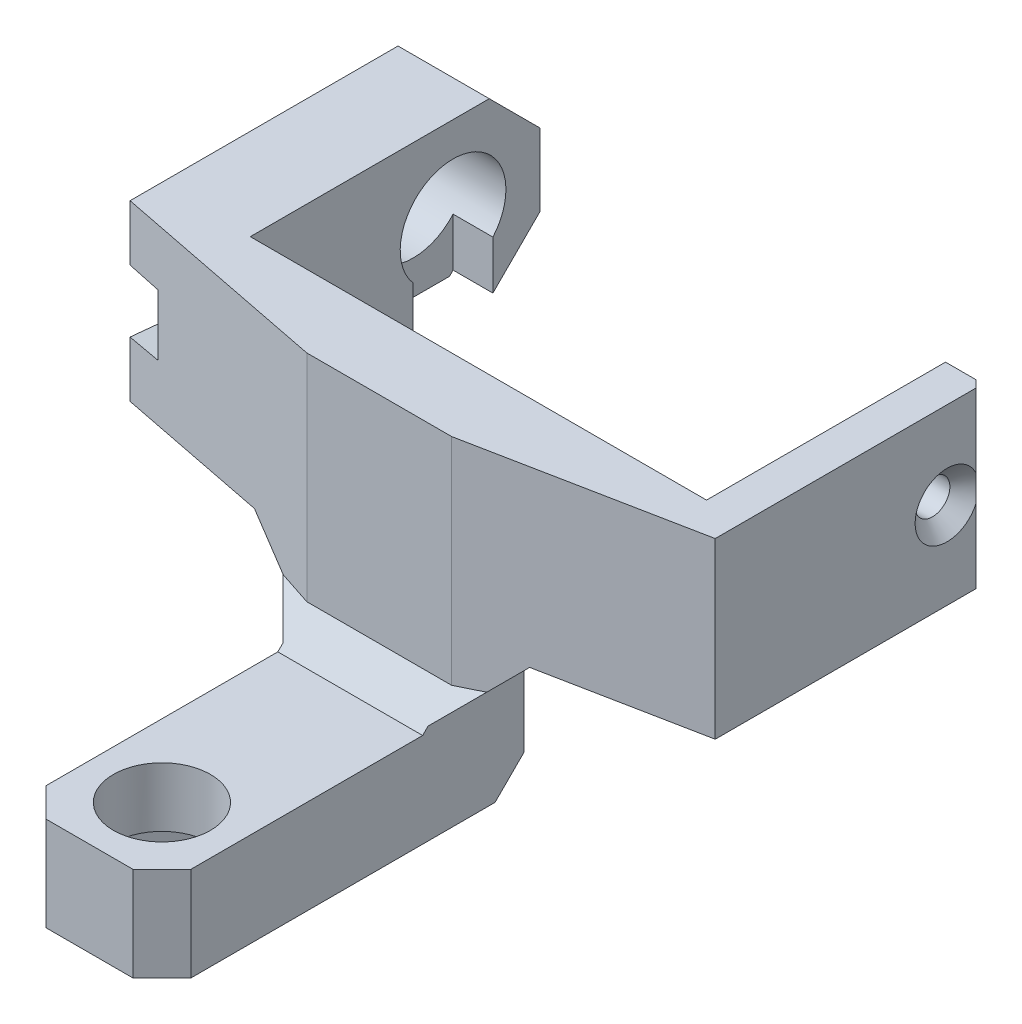
from build123d import *

# Parameters (mm, degrees)
SKETCH1_W                                       = 40.4
SKETCH1_H                                       = 12
BOSS_EXTRUDE1_DEPTH                             = 22
CUT_EXTRUDE1_REACH                              = 34.188
SKETCH2_W                                       = 31.5
SKETCH2_H                                       = 20
CUT_EXTRUDE2_REACH                              = 48.391
SKETCH4_R                                       = 0.9
CHAMFER1_SIZE                                   = 3.5
CSK_FOR_M2_FLAT_HEAD_MACHINE_SCREW1_D           = 2.4
CSK_FOR_M2_FLAT_HEAD_MACHINE_SCREW1_DEPTH       = 12.7
CSK_FOR_M2_FLAT_HEAD_MACHINE_SCREW1_CSINK_D     = 4.4
CSK_FOR_M2_FLAT_HEAD_MACHINE_SCREW1_CSINK_ANGLE = 90
CSK_FOR_M2_FLAT_HEAD_MACHINE_SCREW1_TIP         = 0.721032743
CHAMFER2_SIZE                                   = 4
BOSS_EXTRUDE2_START                             = 0.5
SKETCH20_R                                      = 2.5
SKETCH20_R_2                                    = 1.2
BOSS_EXTRUDE2_DEPTH                             = 0.5
BOSS_EXTRUDE3_DEPTH                             = 12
CUT_EXTRUDE3_DEPTH                              = 2.4
SKETCH23_R                                      = 3.65
CUT_EXTRUDE4_DEPTH                              = 22.4
SKETCH24_W                                      = 5.5
SKETCH24_H                                      = 5.5
CUT_EXTRUDE5_DEPTH                              = 22.4
SKETCH26_W                                      = 10
SKETCH26_H                                      = 5
BOSS_EXTRUDE4_DEPTH                             = 11.375
SKETCH27_W                                      = 10
SKETCH27_H                                      = 25
BOSS_EXTRUDE5_DEPTH                             = 6.5
CUT_EXTRUDE6_DEPTH                              = 2.4
SKETCH29_R                                      = 3.35
CUT_EXTRUDE7_DEPTH                              = 54.60028568
CHAMFER3_SIZE                                   = 2
CHAMFER5_SIZE                                   = 2
CHAMFER6_SIZE                                   = 4.5


with BuildPart() as part:
    # Sketch1 → Boss-Extrude1 (new body)
    with BuildSketch(Plane.XY):
        Rectangle(SKETCH1_W, SKETCH1_H)
    extrude(amount=BOSS_EXTRUDE1_DEPTH)

    # Sketch2 → Cut-Extrude1 (cut, up to next)
    with BuildSketch(Plane(origin=(0, 6, 0), x_dir=(1, 0, 0), z_dir=(0, 1, 0)), mode=Mode.PRIVATE) as cut_extrude1_sk1:
        with Locations((1.85, -10)):
            Rectangle(SKETCH2_W, SKETCH2_H)
    cut_extrude1_tool1 = extrude(cut_extrude1_sk1.sketch, amount=-CUT_EXTRUDE1_REACH, mode=Mode.PRIVATE) & part.part
    add(cut_extrude1_tool1.solids().sort_by_distance((1.85, 6, 10))[0], mode=Mode.SUBTRACT)

    # Sketch4 → Cut-Extrude2 (cut, up to next)
    with BuildSketch(Plane(origin=(20.2, 0, 0), x_dir=(0, 0, -1), z_dir=(1, 0, 0)), mode=Mode.PRIVATE) as cut_extrude2_sk1:
        with Locations((-6, 0)):
            Circle(SKETCH4_R)
    cut_extrude2_tool1 = extrude(cut_extrude2_sk1.sketch, amount=-CUT_EXTRUDE2_REACH, mode=Mode.PRIVATE) & part.part
    add(cut_extrude2_tool1.solids().sort_by_distance((20.2, 0, 6))[0], mode=Mode.SUBTRACT)

    # Chamfer1
    chamfer1_edges = [part.edges().sort_by_distance(p)[0] for p in [
        (-17.05, -6, 0),
        (-17.05, 6, 0),
        (18.9, -6, 0),
        (18.9, 6, 0),
    ]]
    chamfer(chamfer1_edges, length=CHAMFER1_SIZE)

    # CSK for M2 Flat Head Machine Screw1
    with Locations(Plane(origin=(20.2, 0, 0), x_dir=(0, 0, -1), z_dir=(1, 0, 0))):
        with Locations((-6, 0)):
            CounterSinkHole(CSK_FOR_M2_FLAT_HEAD_MACHINE_SCREW1_D / 2, CSK_FOR_M2_FLAT_HEAD_MACHINE_SCREW1_CSINK_D / 2, depth=CSK_FOR_M2_FLAT_HEAD_MACHINE_SCREW1_DEPTH, counter_sink_angle=CSK_FOR_M2_FLAT_HEAD_MACHINE_SCREW1_CSINK_ANGLE)
            with Locations((0, 0, -(CSK_FOR_M2_FLAT_HEAD_MACHINE_SCREW1_DEPTH + CSK_FOR_M2_FLAT_HEAD_MACHINE_SCREW1_TIP / 2))):  # 118° drill point
                Cone(0, CSK_FOR_M2_FLAT_HEAD_MACHINE_SCREW1_D / 2, CSK_FOR_M2_FLAT_HEAD_MACHINE_SCREW1_TIP, mode=Mode.SUBTRACT)

    # Chamfer2
    # the kernel refuses this chamfer: 4 mm, written as the material it takes off along each edge
    with BuildSketch(Plane(origin=(20.2, 12.786731952, 0), x_dir=(-0.9996219169112968, 0, -0.027495876610586365), z_dir=(0, -1, 0))) as chamfer2_piece_1:
        Polygon((CHAMFER2_SIZE * 0.999621916911, -CHAMFER2_SIZE * 0.0274958766106), (-CHAMFER2_SIZE * 0.0274958766106, -CHAMFER2_SIZE * 0.999621916911), (0, 0), align=None)
    extrude(amount=25.573463904, mode=Mode.SUBTRACT)

    # Sketch20 → Boss-Extrude2 (add)
    with BuildSketch(Plane.ZY.offset(-17.6).offset(BOSS_EXTRUDE2_START)):
        with Locations(Location((6, 0, 0), (0, 0, 180))):
            Circle(SKETCH20_R)
        with Locations(Location((6, 0, 0), (0, 0, 180))):
            Circle(SKETCH20_R_2, mode=Mode.SUBTRACT)
    extrude(amount=-BOSS_EXTRUDE2_DEPTH)

    # Sketch25 → Boss-Extrude3 (add, through all)
    with BuildSketch(Plane.XZ.offset(6)):
        Polygon((20.2, 22), (-20.2, 22), (-5, 25), (5, 25), align=None)
    extrude(amount=-BOSS_EXTRUDE3_DEPTH)

    # Sketch5 → Cut-Extrude3 (cut)
    with BuildSketch(Plane.ZY.offset(20.2)):
        with BuildLine():
            Line((6.343920973, 3.633760912), (22.64787234, 2.090656963))
            ThreePointArc((22.64787234, 2.090656963), (24.55, 0), (22.64787234, -2.090656963))
            Line((22.64787234, -2.090656963), (6.343920973, -3.633760912))
            ThreePointArc((6.343920973, -3.633760912), (2.35, 0), (6.343920973, 3.633760912))
        make_face()
    extrude(amount=-CUT_EXTRUDE3_DEPTH, mode=Mode.SUBTRACT)

    # Sketch23 → Cut-Extrude4 (cut)
    with BuildSketch(Plane.ZY.offset(17.8)):
        with Locations((6, 0)):
            Circle(SKETCH23_R)
    extrude(amount=-CUT_EXTRUDE4_DEPTH, mode=Mode.SUBTRACT)

    # Sketch24 → Cut-Extrude5 (cut)
    with BuildSketch(Plane(origin=(0, 0, 0), x_dir=(-1, 0, 0), z_dir=(0, -1, 0))):
        with Locations((13.9, -6)):
            Rectangle(SKETCH24_W, SKETCH24_H)
    extrude(amount=CUT_EXTRUDE5_DEPTH, mode=Mode.SUBTRACT)

    # Sketch26 → Boss-Extrude4 (add)
    with BuildSketch(Plane(origin=(0, -6, 0), x_dir=(1, 0, 0), z_dir=(0, 1, 0))):
        with Locations((0, -22.5)):
            Rectangle(SKETCH26_W, SKETCH26_H)
    extrude(amount=-BOSS_EXTRUDE4_DEPTH)

    # Sketch27 → Boss-Extrude5 (add)
    with BuildSketch(Plane(origin=(0, -17.375, 0), x_dir=(-1, 0, 0), z_dir=(0, -1, 0))):
        with Locations((0, -32.5)):
            Rectangle(SKETCH27_W, SKETCH27_H)
    extrude(amount=-BOSS_EXTRUDE5_DEPTH)

    # Sketch28 → Cut-Extrude6 (cut)
    with BuildSketch(Plane(origin=(0, -17.375, 0), x_dir=(-1, 0, 0), z_dir=(0, -1, 0))):
        with BuildLine():
            Line((-1.791991683, -23.380395137), (-3.335095631, -39.684346505))
            ThreePointArc((-3.335095631, -39.684346505), (0, -43.35), (3.335095631, -39.684346505))
            Line((3.335095631, -39.684346505), (1.791991683, -23.380395137))
            ThreePointArc((1.791991683, -23.380395137), (0, -21.75), (-1.791991683, -23.380395137))
        make_face()
    extrude(amount=-CUT_EXTRUDE6_DEPTH, mode=Mode.SUBTRACT)

    # Sketch29 → Cut-Extrude7 (cut, through all)
    with BuildSketch(Plane(origin=(0, -14.975, 0), x_dir=(-1, 0, 0), z_dir=(0, -1, 0))):
        with Locations(Location((0, -40, 0), (0, 0, 174.593288878))):
            Circle(SKETCH29_R)
    extrude(amount=-CUT_EXTRUDE7_DEPTH, mode=Mode.SUBTRACT)

    # Chamfer3
    # the kernel refuses this chamfer: 2 mm, written as the material it takes off along each edge
    with BuildSketch(Plane(origin=(10.143365976, -17.375, 20), x_dir=(0, 0.9996219169112968, -0.0274958766105856), z_dir=(-1, 0, 0))) as chamfer3_piece_1:
        Polygon((CHAMFER3_SIZE * 0.999621916911, -CHAMFER3_SIZE * 0.0274958766106), (-CHAMFER3_SIZE * 0.0274958766106, -CHAMFER3_SIZE * 0.999621916911), (0, 0), align=None)
    extrude(amount=20.286731952, mode=Mode.SUBTRACT)
    with BuildSketch(Plane(origin=(-5, -22.518365976, 45), x_dir=(-0.02749587661058651, 0, -0.9996219169112968), z_dir=(0, 1, 0))) as chamfer3_piece_2:
        Polygon((CHAMFER3_SIZE * 0.999621916911, -CHAMFER3_SIZE * 0.0274958766106), (-CHAMFER3_SIZE * 0.0274958766106, -CHAMFER3_SIZE * 0.999621916911), (0, 0), align=None)
    extrude(amount=16.786731952, mode=Mode.SUBTRACT)
    with BuildSketch(Plane(origin=(5, -22.518365976, 45), x_dir=(0.02749587661058651, 0, -0.9996219169112968), z_dir=(0, 1, 0))) as chamfer3_piece_3:
        Polygon((CHAMFER3_SIZE * 0.999621916911, CHAMFER3_SIZE * 0.0274958766106), (-CHAMFER3_SIZE * 0.0274958766106, CHAMFER3_SIZE * 0.999621916911), (0, 0), align=None)
    extrude(amount=16.786731952, mode=Mode.SUBTRACT)

    # Chamfer5
    chamfer5_edges = [part.edges().sort_by_distance(p)[0] for p in [
        (0, -10.875, 25),
    ]]
    chamfer(chamfer5_edges, length=CHAMFER5_SIZE)

    # Chamfer6
    # the kernel refuses this chamfer: 4.5 mm, written as the material it adds along each edge
    with BuildSketch(Plane(origin=(-5, -6, 20), x_dir=(0.027495876610586587, -0.9996219169112966, 0), z_dir=(0, 0, 1))) as chamfer6_piece_1_section:
        Polygon((CHAMFER6_SIZE * 0.999621916911, -CHAMFER6_SIZE * 0.0274958766106), (-CHAMFER6_SIZE * 0.0274958766106, -CHAMFER6_SIZE * 0.999621916911), (0, 0), align=None)
    chamfer6_piece_1 = extrude(amount=16.572573446, mode=Mode.PRIVATE)
    chamfer6_piece_1 = split(chamfer6_piece_1, bisect_by=Plane(origin=(-6.365694547, -6.762864523, 22.887864523), z_dir=(0, -0.7071067811865476, -0.7071067811865476)), keep=Keep.TOP, mode=Mode.PRIVATE)
    add(chamfer6_piece_1)
    with BuildSketch(Plane(origin=(-5, -6, 20), x_dir=(0.027495876610586587, -0.9996219169112966, 0), z_dir=(0, 0, 1))) as chamfer6_piece_2_section:
        Polygon((CHAMFER6_SIZE * 0.999621916911, -CHAMFER6_SIZE * 0.0274958766106), (-CHAMFER6_SIZE * 0.0274958766106, -CHAMFER6_SIZE * 0.999621916911), (0, 0), align=None)
    chamfer6_piece_2 = extrude(amount=16.572573446, mode=Mode.PRIVATE)
    chamfer6_piece_2 = split(chamfer6_piece_2, bisect_by=Plane(origin=(-6.882801267, -6.788517358, 24.628394487), z_dir=(0.19363303189666034, 0, -0.9810740282764124)), keep=Keep.TOP, mode=Mode.PRIVATE)
    add(chamfer6_piece_2)
    with BuildSketch(Plane(origin=(5, -6, 36.572573446), x_dir=(-0.0274958766105862, -0.9996219169112969, 0), z_dir=(0, 0, -1))) as chamfer6_piece_3_section:
        Polygon((CHAMFER6_SIZE * 0.999621916911, -CHAMFER6_SIZE * 0.0274958766106), (-CHAMFER6_SIZE * 0.0274958766106, -CHAMFER6_SIZE * 0.999621916911), (0, 0), align=None)
    chamfer6_piece_3 = extrude(amount=16.572573446, mode=Mode.PRIVATE)
    chamfer6_piece_3 = split(chamfer6_piece_3, bisect_by=Plane(origin=(5.40625, -9.484375, 25.609375), z_dir=(0, -0.7071067811865476, -0.7071067811865476)), keep=Keep.TOP, mode=Mode.PRIVATE)
    add(chamfer6_piece_3)
    with BuildSketch(Plane(origin=(5, -6, 36.572573446), x_dir=(-0.0274958766105862, -0.9996219169112969, 0), z_dir=(0, 0, -1))) as chamfer6_piece_4_section:
        Polygon((CHAMFER6_SIZE * 0.999621916911, -CHAMFER6_SIZE * 0.0274958766106), (-CHAMFER6_SIZE * 0.0274958766106, -CHAMFER6_SIZE * 0.999621916911), (0, 0), align=None)
    chamfer6_piece_4 = extrude(amount=16.572573446, mode=Mode.PRIVATE)
    chamfer6_piece_4 = split(chamfer6_piece_4, bisect_by=Plane(origin=(6.882801267, -6.788517358, 24.628394487), z_dir=(-0.19363303189666034, 0, -0.9810740282764124)), keep=Keep.TOP, mode=Mode.PRIVATE)
    add(chamfer6_piece_4)


solid = part.part
